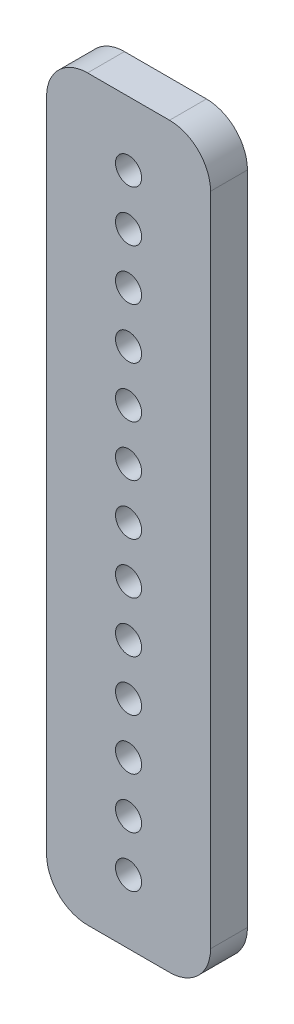
from build123d import *

# Parameters (mm, degrees)
SKETCH1_W           = 25.4
SKETCH1_H           = 114.3
BOSS_EXTRUDE1_DEPTH = 5.715
SKETCH2_R           = 2.0193
CUT_EXTRUDE1_DEPTH  = 5.715
FILLET1_R           = 6.35


with BuildPart() as part:
    # Sketch1 → Boss-Extrude1 (new body)
    with BuildSketch(Plane.XY):
        Rectangle(SKETCH1_W, SKETCH1_H)
    extrude(amount=BOSS_EXTRUDE1_DEPTH)

    # Sketch2 → Cut-Extrude1 (cut)
    with BuildSketch(Plane.XY.offset(5.715)):
        Circle(SKETCH2_R)
        with Locations((0, 7.874)):
            Circle(SKETCH2_R)
        with Locations((0, 15.748)):
            Circle(SKETCH2_R)
        with Locations((0, 23.622)):
            Circle(SKETCH2_R)
        with Locations((0, 31.496)):
            Circle(SKETCH2_R)
        with Locations((0, 39.37)):
            Circle(SKETCH2_R)
        with Locations((0, 47.244)):
            Circle(SKETCH2_R)
        with Locations((0, -7.874)):
            Circle(SKETCH2_R)
        with Locations((0, -15.748)):
            Circle(SKETCH2_R)
        with Locations((0, -23.622)):
            Circle(SKETCH2_R)
        with Locations((0, -31.496)):
            Circle(SKETCH2_R)
        with Locations((0, -39.37)):
            Circle(SKETCH2_R)
        with Locations((0, -47.244)):
            Circle(SKETCH2_R)
    extrude(amount=-CUT_EXTRUDE1_DEPTH, mode=Mode.SUBTRACT)

    # Fillet1
    fillet1_edges = [part.edges().sort_by_distance(p)[0] for p in [
        (12.7, -57.15, 2.8575),
        (-12.7, -57.15, 2.8575),
        (12.7, 57.15, 2.8575),
        (-12.7, 57.15, 2.8575),
    ]]
    fillet(fillet1_edges, radius=FILLET1_R)


solid = part.part
